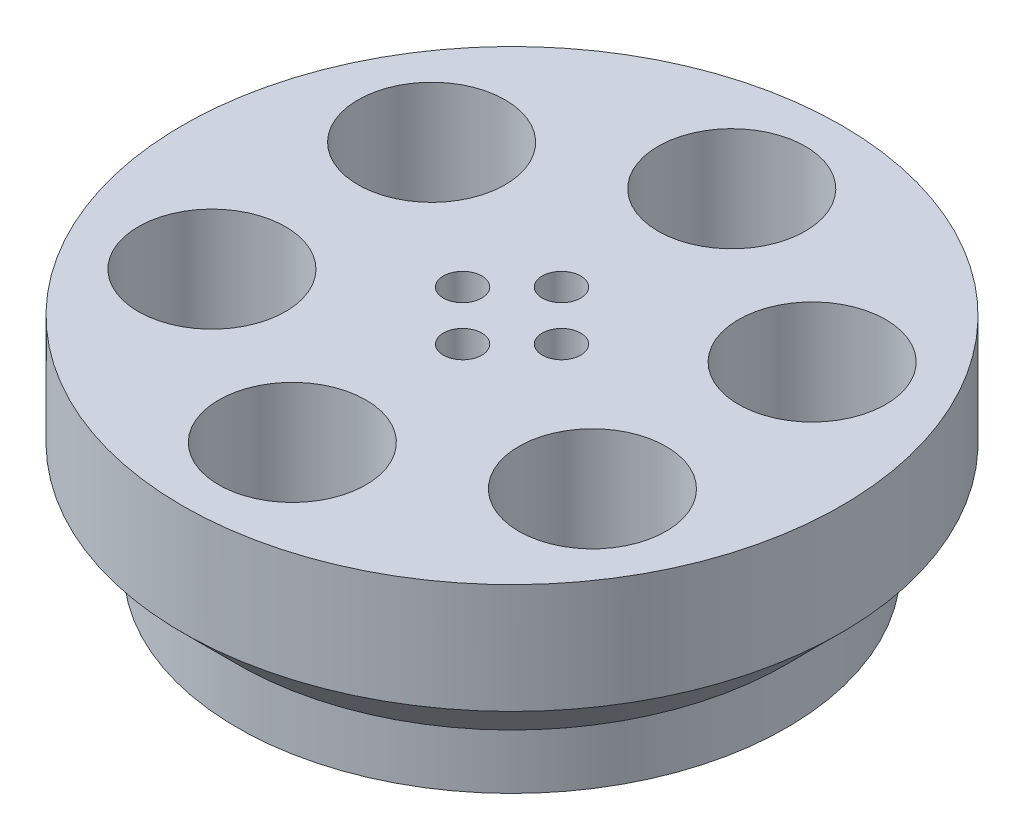
from build123d import *

# Parameters (mm, degrees)
SKETCH1_R           = 30
BOSS_EXTRUDE1_DEPTH = 20
SKETCH2_R           = 6.7
CUT_EXTRUDE1_DEPTH  = 10
SKETCH3_R           = 2
CUT_EXTRUDE2_DEPTH  = 35
CIRPATTERN1_COUNT   = 6
SKETCH6_R           = 1.75
CUT_EXTRUDE4_DEPTH  = 45
CIRPATTERN3_COUNT   = 4


with BuildPart() as part:
    # Sketch1 → Boss-Extrude1 (new body)
    with BuildSketch(Plane(origin=(0, 0, 0), x_dir=(1, 0, 0), z_dir=(0, 1, 0))):
        Circle(SKETCH1_R)
    extrude(amount=BOSS_EXTRUDE1_DEPTH)

    # Sketch2 → Cut-Extrude1 (cut)
    with BuildSketch(Plane(origin=(0, 20, 0), x_dir=(1, 0, 0), z_dir=(0, 1, 0))):
        with Locations((0, 20)):
            Circle(SKETCH2_R)
    cut_extrude1 = extrude(amount=-CUT_EXTRUDE1_DEPTH, mode=Mode.SUBTRACT)

    # Sketch3 → Cut-Extrude2 (cut)
    with BuildSketch(Plane(origin=(0, 10, 0), x_dir=(1, 0, 0), z_dir=(0, 1, 0))):
        with Locations((0, 20)):
            Circle(SKETCH3_R)
    cut_extrude2 = extrude(amount=-CUT_EXTRUDE2_DEPTH, mode=Mode.SUBTRACT)

    # CirPattern1: Cut-Extrude1, Cut-Extrude2 ×6 about axis
    cirpattern1_axis = Axis((0, 20, 0), (0, 1, 0))
    add([cut_extrude1.rotate(cirpattern1_axis, i * 360 / CIRPATTERN1_COUNT) for i in range(1, CIRPATTERN1_COUNT)], mode=Mode.SUBTRACT)
    add([cut_extrude2.rotate(cirpattern1_axis, i * 360 / CIRPATTERN1_COUNT) for i in range(1, CIRPATTERN1_COUNT)], mode=Mode.SUBTRACT)

    # Sketch6 → Cut-Extrude4 (cut)
    with BuildSketch(Plane(origin=(0, 20, 0), x_dir=(1, 0, 0), z_dir=(0, 1, 0))):
        with Locations((4.5, 0)):
            Circle(SKETCH6_R)
    cut_extrude4 = extrude(amount=-CUT_EXTRUDE4_DEPTH, mode=Mode.SUBTRACT)

    # CirPattern3: Cut-Extrude4 ×4 about axis
    cirpattern3_axis = Axis((0, 20, 0), (0, 1, 0))
    for i in range(1, CIRPATTERN3_COUNT):
        add(cut_extrude4.rotate(cirpattern3_axis, i * 360 / CIRPATTERN3_COUNT), mode=Mode.SUBTRACT)

    # Sketch7 → Cut-Revolve1 (revolve, cut)
    with BuildSketch(Plane.XY):
        Polygon((-25, 0), (-25, 5), (-30, 10), (-30, 0), align=None)
    revolve(axis=Axis((0, 0, 0), (0, 1, 0)), mode=Mode.SUBTRACT)


solid = part.part
